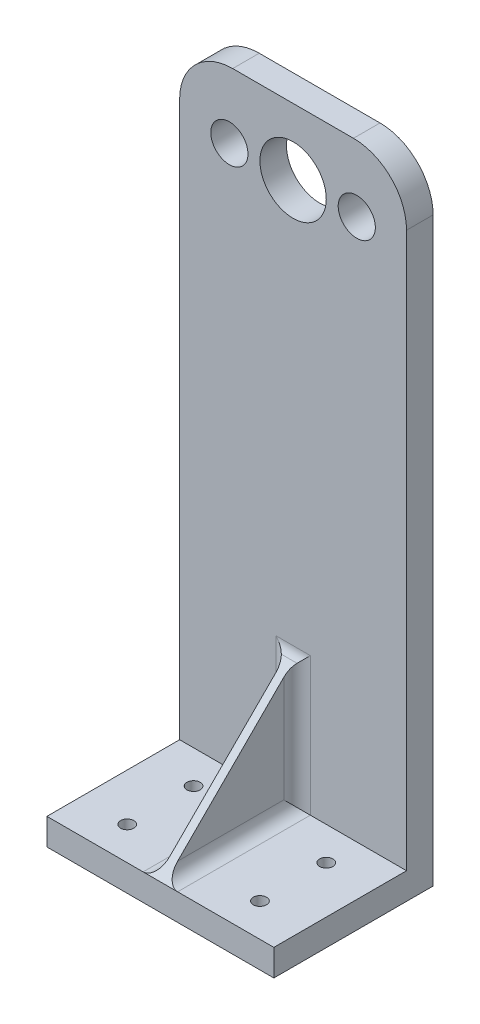
from build123d import *

# Parameters (mm, degrees)
SKETCH2_W                = 21.717
SKETCH2_H                = 60.706
SKETCH2_R                = 3.175
SKETCH2_R_2              = 1.778
BOSS_EXTRUDE1_DEPTH      = 2.54
SKETCH3_W                = 21.717
SKETCH3_H                = 2.54
BOSS_EXTRUDE2_DEPTH      = 12.7
BOSS_EXTRUDE3_DEPTH      = 0.381
BOSS_EXTRUDE3_DEPTH_BACK = 0.381
SKETCH6_R                = 0.635
CUT_EXTRUDE1_DEPTH       = 62.101949054
FILLET1_R                = 5.08
FILLET2_R                = 1.27


with BuildPart() as part:
    # Sketch2 → Boss-Extrude1 (new body)
    with BuildSketch(Plane.XY):
        with Locations((0, -24.003)):
            Rectangle(SKETCH2_W, SKETCH2_H)
        Circle(SKETCH2_R, mode=Mode.SUBTRACT)
        with Locations((6.096, 0)):
            Circle(SKETCH2_R_2, mode=Mode.SUBTRACT)
        with Locations((-6.096, 0)):
            Circle(SKETCH2_R_2, mode=Mode.SUBTRACT)
    extrude(amount=BOSS_EXTRUDE1_DEPTH)

    # Sketch3 → Boss-Extrude2 (add)
    with BuildSketch(Plane.XY.offset(2.54)):
        with Locations((0, -53.086)):
            Rectangle(SKETCH3_W, SKETCH3_H)
    extrude(amount=BOSS_EXTRUDE2_DEPTH)

    # Sketch5 → Boss-Extrude3 (add, two sides: drawn at the far end of the back side and taken through both)
    with BuildSketch(Plane.ZY.offset(-BOSS_EXTRUDE3_DEPTH_BACK)):
        Polygon((15.24, -51.816), (2.54, -51.816), (2.54, -39.116), align=None)
    extrude(amount=BOSS_EXTRUDE3_DEPTH + BOSS_EXTRUDE3_DEPTH_BACK)

    # Sketch6 → Cut-Extrude1 (cut, through all)
    with BuildSketch(Plane(origin=(0, -51.816, 0), x_dir=(1, 0, 0), z_dir=(0, 1, 0))):
        with Locations(Location((-6.35, -5.715, 0), (0, 0, 270))):
            Circle(SKETCH6_R)
        with Locations(Location((6.35, -5.715, 0), (0, 0, 270))):
            Circle(SKETCH6_R)
        with Locations(Location((6.35, -12.065, 0), (0, 0, 270))):
            Circle(SKETCH6_R)
        with Locations(Location((-6.35, -12.065, 0), (0, 0, 270))):
            Circle(SKETCH6_R)
    extrude(amount=-CUT_EXTRUDE1_DEPTH, mode=Mode.SUBTRACT)

    # Fillet1
    fillet1_edges = [part.edges().sort_by_distance(p)[0] for p in [
        (10.8585, 6.35, 1.27),
        (-10.8585, 6.35, 1.27),
    ]]
    fillet(fillet1_edges, radius=FILLET1_R)

    # Fillet2
    # the kernel refuses this fillet: 1.27 mm, written as the material it adds along each edge
    with BuildSketch(Plane(origin=(0.381, -51.816, 2.54), x_dir=(1, 0, 0), z_dir=(0, 1, 0))) as fillet2_piece_1_section:
        with BuildLine():
            CenterArc((FILLET2_R, -FILLET2_R), FILLET2_R, 90, 90)
            Line((0, -FILLET2_R), (-FILLET2_R * 0.02, -FILLET2_R))
            Line((-FILLET2_R * 0.02, -FILLET2_R), (-FILLET2_R * 0.02, FILLET2_R * 0.02))
            Line((-FILLET2_R * 0.02, FILLET2_R * 0.02), (FILLET2_R, FILLET2_R * 0.02))
            Line((FILLET2_R, FILLET2_R * 0.02), (FILLET2_R, 0))
        make_face()
    fillet2_piece_1 = extrude(amount=15.875, mode=Mode.PRIVATE)
    fillet2_piece_1 = split(fillet2_piece_1, bisect_by=Plane(origin=(0.67208957, -42.502111902, 5.926111902), z_dir=(0, -0.7071067811865475, -0.7071067811865477)), keep=Keep.TOP, mode=Mode.PRIVATE)
    add(fillet2_piece_1)
    with BuildSketch(Plane(origin=(-0.381, -51.816, 2.54), x_dir=(-1, 0, 0), z_dir=(0, 1, 0))) as fillet2_piece_2_section:
        with BuildLine():
            CenterArc((FILLET2_R, FILLET2_R), FILLET2_R, 180, 90)
            Line((0, FILLET2_R), (-FILLET2_R * 0.02, FILLET2_R))
            Line((-FILLET2_R * 0.02, FILLET2_R), (-FILLET2_R * 0.02, -FILLET2_R * 0.02))
            Line((-FILLET2_R * 0.02, -FILLET2_R * 0.02), (FILLET2_R, -FILLET2_R * 0.02))
            Line((FILLET2_R, -FILLET2_R * 0.02), (FILLET2_R, 0))
        make_face()
    fillet2_piece_2 = extrude(amount=15.875, mode=Mode.PRIVATE)
    fillet2_piece_2 = split(fillet2_piece_2, bisect_by=Plane(origin=(-0.67208957, -42.502111902, 5.926111902), z_dir=(0, -0.7071067811865475, -0.7071067811865477)), keep=Keep.TOP, mode=Mode.PRIVATE)
    add(fillet2_piece_2)
    with BuildSketch(Plane(origin=(-0.381, -51.816, 15.24), x_dir=(0, 1, 0), z_dir=(0, 0, -1))) as fillet2_piece_3_section:
        with BuildLine():
            CenterArc((FILLET2_R, -FILLET2_R), FILLET2_R, 90, 90)
            Line((0, -FILLET2_R), (-FILLET2_R * 0.02, -FILLET2_R))
            Line((-FILLET2_R * 0.02, -FILLET2_R), (-FILLET2_R * 0.02, FILLET2_R * 0.02))
            Line((-FILLET2_R * 0.02, FILLET2_R * 0.02), (FILLET2_R, FILLET2_R * 0.02))
            Line((FILLET2_R, FILLET2_R * 0.02), (FILLET2_R, 0))
        make_face()
    fillet2_piece_3 = extrude(amount=12.7, mode=Mode.PRIVATE)
    fillet2_piece_3 = split(fillet2_piece_3, bisect_by=Plane(origin=(-0.672062457, -48.429609874, 11.853609874), z_dir=(0, -0.7071067811865475, -0.7071067811865477)), keep=Keep.TOP, mode=Mode.PRIVATE)
    add(fillet2_piece_3)
    with BuildSketch(Plane(origin=(0.381, -51.816, 15.24), x_dir=(1, 0, 0), z_dir=(0, 0, -1))) as fillet2_piece_4_section:
        with BuildLine():
            CenterArc((FILLET2_R, -FILLET2_R), FILLET2_R, 90, 90)
            Line((0, -FILLET2_R), (-FILLET2_R * 0.02, -FILLET2_R))
            Line((-FILLET2_R * 0.02, -FILLET2_R), (-FILLET2_R * 0.02, FILLET2_R * 0.02))
            Line((-FILLET2_R * 0.02, FILLET2_R * 0.02), (FILLET2_R, FILLET2_R * 0.02))
            Line((FILLET2_R, FILLET2_R * 0.02), (FILLET2_R, 0))
        make_face()
    fillet2_piece_4 = extrude(amount=12.7, mode=Mode.PRIVATE)
    fillet2_piece_4 = split(fillet2_piece_4, bisect_by=Plane(origin=(0.672062457, -48.429609874, 11.853609874), z_dir=(0, -0.7071067811865475, -0.7071067811865477)), keep=Keep.TOP, mode=Mode.PRIVATE)
    add(fillet2_piece_4)
    with BuildSketch(Plane(origin=(0.381, -39.116, 2.54), x_dir=(0, 1, 0), z_dir=(-1, 0, 0))) as fillet2_piece_5:
        with BuildLine():
            CenterArc((FILLET2_R * 0.414213562373, -FILLET2_R), FILLET2_R, 90, 45)
            Line((-FILLET2_R * 0.292893218813, -FILLET2_R * 0.292893218813), (-FILLET2_R * 0.307035354437, -FILLET2_R * 0.27875108319))
            Line((-FILLET2_R * 0.307035354437, -FILLET2_R * 0.27875108319), (-FILLET2_R * 0.00828427124746, FILLET2_R * 0.02))
            Line((-FILLET2_R * 0.00828427124746, FILLET2_R * 0.02), (FILLET2_R * 0.414213562373, FILLET2_R * 0.02))
            Line((FILLET2_R * 0.414213562373, FILLET2_R * 0.02), (FILLET2_R * 0.414213562373, 0))
        make_face()
    extrude(amount=0.762)
    with BuildSketch(Plane(origin=(0.381, -54.991, 2.54), x_dir=(1, 0, 0), z_dir=(0, 1, 0))) as fillet2_piece_6a_section:
        with BuildLine():
            CenterArc((FILLET2_R, -FILLET2_R), FILLET2_R, 90, 90)
            Line((0, -FILLET2_R), (-FILLET2_R * 0.02, -FILLET2_R))
            Line((-FILLET2_R * 0.02, -FILLET2_R), (-FILLET2_R * 0.02, FILLET2_R * 0.02))
            Line((-FILLET2_R * 0.02, FILLET2_R * 0.02), (FILLET2_R, FILLET2_R * 0.02))
            Line((FILLET2_R, FILLET2_R * 0.02), (FILLET2_R, 0))
        make_face()
    fillet2_piece_6a = extrude(amount=19.05, mode=Mode.PRIVATE)
    fillet2_piece_6a = split(fillet2_piece_6a, bisect_by=Plane(origin=(0.668521795, -51.816, 2.827521795), z_dir=(0, -1, 0)), keep=Keep.TOP, mode=Mode.PRIVATE)
    with BuildSketch(Plane(origin=(0.381, -51.816, 15.24), x_dir=(1, 0, 0), z_dir=(0, 0, -1))) as fillet2_piece_6b_section:
        with BuildLine():
            CenterArc((FILLET2_R, -FILLET2_R), FILLET2_R, 90, 90)
            Line((0, -FILLET2_R), (-FILLET2_R * 0.02, -FILLET2_R))
            Line((-FILLET2_R * 0.02, -FILLET2_R), (-FILLET2_R * 0.02, FILLET2_R * 0.02))
            Line((-FILLET2_R * 0.02, FILLET2_R * 0.02), (FILLET2_R, FILLET2_R * 0.02))
            Line((FILLET2_R, FILLET2_R * 0.02), (FILLET2_R, 0))
        make_face()
    fillet2_piece_6b = extrude(amount=15.875, mode=Mode.PRIVATE)
    fillet2_piece_6b = split(fillet2_piece_6b, bisect_by=Plane(origin=(0.668521795, -51.528478205, 2.54), z_dir=(0, 0, -1)), keep=Keep.TOP, mode=Mode.PRIVATE)
    fillet2_piece_6 = fillet2_piece_6a & fillet2_piece_6b
    add(fillet2_piece_6)
    with BuildSketch(Plane(origin=(0.381, -51.816, 2.54), x_dir=(1, 0, 0), z_dir=(0, 1, 0))) as fillet2_piece_7a_section:
        with BuildLine():
            CenterArc((FILLET2_R, -FILLET2_R), FILLET2_R, 90, 90)
            Line((0, -FILLET2_R), (-FILLET2_R * 0.02, -FILLET2_R))
            Line((-FILLET2_R * 0.02, -FILLET2_R), (-FILLET2_R * 0.02, FILLET2_R * 0.02))
            Line((-FILLET2_R * 0.02, FILLET2_R * 0.02), (FILLET2_R, FILLET2_R * 0.02))
            Line((FILLET2_R, FILLET2_R * 0.02), (FILLET2_R, 0))
        make_face()
    fillet2_piece_7a = extrude(amount=15.875, mode=Mode.PRIVATE)
    fillet2_piece_7a = split(fillet2_piece_7a, bisect_by=Plane(origin=(0.655732005, -38.554128536, 1.978128536), z_dir=(0, 0.7071067811865475, 0.7071067811865477)), keep=Keep.TOP, mode=Mode.PRIVATE)
    with BuildSketch(Plane(origin=(1.696128061, -39.116, 2.54), x_dir=(0, 1, 0), z_dir=(-1, 0, 0))) as fillet2_piece_7b_section:
        with BuildLine():
            CenterArc((FILLET2_R * 0.414213562373, -FILLET2_R), FILLET2_R, 90, 45)
            Line((-FILLET2_R * 0.292893218813, -FILLET2_R * 0.292893218813), (-FILLET2_R * 0.307035354437, -FILLET2_R * 0.27875108319))
            Line((-FILLET2_R * 0.307035354437, -FILLET2_R * 0.27875108319), (-FILLET2_R * 0.00828427124746, FILLET2_R * 0.02))
            Line((-FILLET2_R * 0.00828427124746, FILLET2_R * 0.02), (FILLET2_R * 0.414213562373, FILLET2_R * 0.02))
            Line((FILLET2_R * 0.414213562373, FILLET2_R * 0.02), (FILLET2_R * 0.414213562373, 0))
        make_face()
    fillet2_piece_7b = extrude(amount=2.077128061, mode=Mode.PRIVATE)
    fillet2_piece_7b = split(fillet2_piece_7b, bisect_by=Plane(origin=(0.381, -39.083484699, 2.618498881), z_dir=(1, 0, 0)), keep=Keep.TOP, mode=Mode.PRIVATE)
    fillet2_piece_7 = fillet2_piece_7a & fillet2_piece_7b
    add(fillet2_piece_7)
    with BuildSketch(Plane(origin=(-0.381, -54.991, 2.54), x_dir=(-1, 0, 0), z_dir=(0, 1, 0))) as fillet2_piece_8a_section:
        with BuildLine():
            CenterArc((FILLET2_R, FILLET2_R), FILLET2_R, 180, 90)
            Line((0, FILLET2_R), (-FILLET2_R * 0.02, FILLET2_R))
            Line((-FILLET2_R * 0.02, FILLET2_R), (-FILLET2_R * 0.02, -FILLET2_R * 0.02))
            Line((-FILLET2_R * 0.02, -FILLET2_R * 0.02), (FILLET2_R, -FILLET2_R * 0.02))
            Line((FILLET2_R, -FILLET2_R * 0.02), (FILLET2_R, 0))
        make_face()
    fillet2_piece_8a = extrude(amount=19.05, mode=Mode.PRIVATE)
    fillet2_piece_8a = split(fillet2_piece_8a, bisect_by=Plane(origin=(-0.668521795, -51.816, 2.827521795), z_dir=(0, -1, 0)), keep=Keep.TOP, mode=Mode.PRIVATE)
    with BuildSketch(Plane(origin=(-0.381, -51.816, 15.24), x_dir=(0, 1, 0), z_dir=(0, 0, -1))) as fillet2_piece_8b_section:
        with BuildLine():
            CenterArc((FILLET2_R, -FILLET2_R), FILLET2_R, 90, 90)
            Line((0, -FILLET2_R), (-FILLET2_R * 0.02, -FILLET2_R))
            Line((-FILLET2_R * 0.02, -FILLET2_R), (-FILLET2_R * 0.02, FILLET2_R * 0.02))
            Line((-FILLET2_R * 0.02, FILLET2_R * 0.02), (FILLET2_R, FILLET2_R * 0.02))
            Line((FILLET2_R, FILLET2_R * 0.02), (FILLET2_R, 0))
        make_face()
    fillet2_piece_8b = extrude(amount=15.875, mode=Mode.PRIVATE)
    fillet2_piece_8b = split(fillet2_piece_8b, bisect_by=Plane(origin=(-0.668521795, -51.528478205, 2.54), z_dir=(0, 0, -1)), keep=Keep.TOP, mode=Mode.PRIVATE)
    fillet2_piece_8 = fillet2_piece_8a & fillet2_piece_8b
    add(fillet2_piece_8)
    with BuildSketch(Plane(origin=(0.381, -39.116, 2.54), x_dir=(0, 1, 0), z_dir=(-1, 0, 0))) as fillet2_piece_9a_section:
        with BuildLine():
            CenterArc((FILLET2_R * 0.414213562373, -FILLET2_R), FILLET2_R, 90, 45)
            Line((-FILLET2_R * 0.292893218813, -FILLET2_R * 0.292893218813), (-FILLET2_R * 0.307035354437, -FILLET2_R * 0.27875108319))
            Line((-FILLET2_R * 0.307035354437, -FILLET2_R * 0.27875108319), (-FILLET2_R * 0.00828427124746, FILLET2_R * 0.02))
            Line((-FILLET2_R * 0.00828427124746, FILLET2_R * 0.02), (FILLET2_R * 0.414213562373, FILLET2_R * 0.02))
            Line((FILLET2_R * 0.414213562373, FILLET2_R * 0.02), (FILLET2_R * 0.414213562373, 0))
        make_face()
    fillet2_piece_9a = extrude(amount=2.077128061, mode=Mode.PRIVATE)
    fillet2_piece_9a = split(fillet2_piece_9a, bisect_by=Plane(origin=(-0.381, -39.083484699, 2.618498881), z_dir=(-1, 0, 0)), keep=Keep.TOP, mode=Mode.PRIVATE)
    with BuildSketch(Plane(origin=(-0.381, -51.816, 2.54), x_dir=(-1, 0, 0), z_dir=(0, 1, 0))) as fillet2_piece_9b_section:
        with BuildLine():
            CenterArc((FILLET2_R, FILLET2_R), FILLET2_R, 180, 90)
            Line((0, FILLET2_R), (-FILLET2_R * 0.02, FILLET2_R))
            Line((-FILLET2_R * 0.02, FILLET2_R), (-FILLET2_R * 0.02, -FILLET2_R * 0.02))
            Line((-FILLET2_R * 0.02, -FILLET2_R * 0.02), (FILLET2_R, -FILLET2_R * 0.02))
            Line((FILLET2_R, -FILLET2_R * 0.02), (FILLET2_R, 0))
        make_face()
    fillet2_piece_9b = extrude(amount=15.875, mode=Mode.PRIVATE)
    fillet2_piece_9b = split(fillet2_piece_9b, bisect_by=Plane(origin=(-0.655732005, -38.554128536, 1.978128536), z_dir=(0, 0.7071067811865475, 0.7071067811865477)), keep=Keep.TOP, mode=Mode.PRIVATE)
    fillet2_piece_9 = fillet2_piece_9a & fillet2_piece_9b
    add(fillet2_piece_9)


solid = part.part
